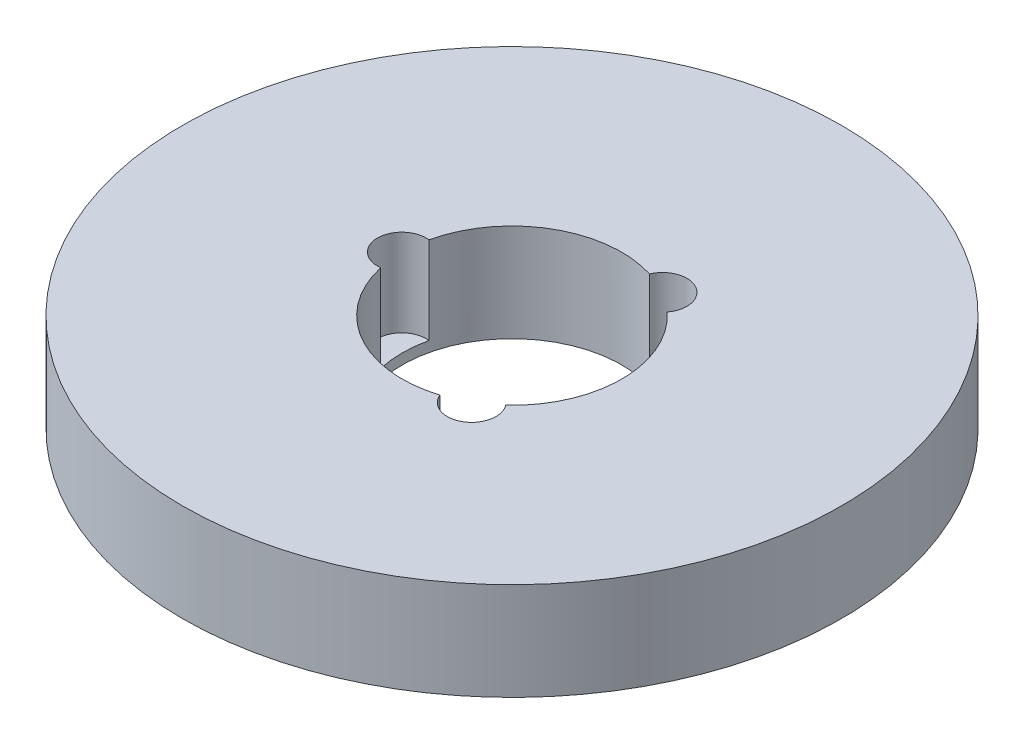
from build123d import *

# Parameters (mm, degrees)
SKETCH1_R           = 67.5
BOSS_EXTRUDE1_DEPTH = 20
SKETCH2_R           = 22.5
CUT_EXTRUDE1_DEPTH  = 98.532046016
SKETCH3_R           = 4.983016428
CUT_EXTRUDE2_DEPTH  = 17.865401114
CIRPATTERN1_COUNT   = 3


with BuildPart() as part:
    # Sketch1 → Boss-Extrude1 (new body)
    with BuildSketch(Plane(origin=(0, 0, 0), x_dir=(1, 0, 0), z_dir=(0, 1, 0))):
        Circle(SKETCH1_R)
    extrude(amount=BOSS_EXTRUDE1_DEPTH)

    # Sketch2 → Cut-Extrude1 (cut, through all)
    with BuildSketch(Plane(origin=(0, 0, 0), x_dir=(1, 0, 0), z_dir=(0, 1, 0))):
        Circle(SKETCH2_R)
    extrude(amount=CUT_EXTRUDE1_DEPTH, mode=Mode.SUBTRACT)

    # Sketch3 → Cut-Extrude2 (cut)
    with BuildSketch(Plane(origin=(0, 20, 0), x_dir=(1, 0, 0), z_dir=(0, 1, 0))):
        with Locations((-22.572089168, 0)):
            Circle(SKETCH3_R)
    cut_extrude2 = extrude(amount=-CUT_EXTRUDE2_DEPTH, mode=Mode.SUBTRACT)

    # CirPattern1: Cut-Extrude2 ×3 about axis
    cirpattern1_axis = Axis((0, 0, 0), (0, 1, 0))
    for i in range(1, CIRPATTERN1_COUNT):
        add(cut_extrude2.rotate(cirpattern1_axis, i * 360 / CIRPATTERN1_COUNT), mode=Mode.SUBTRACT)


solid = part.part
